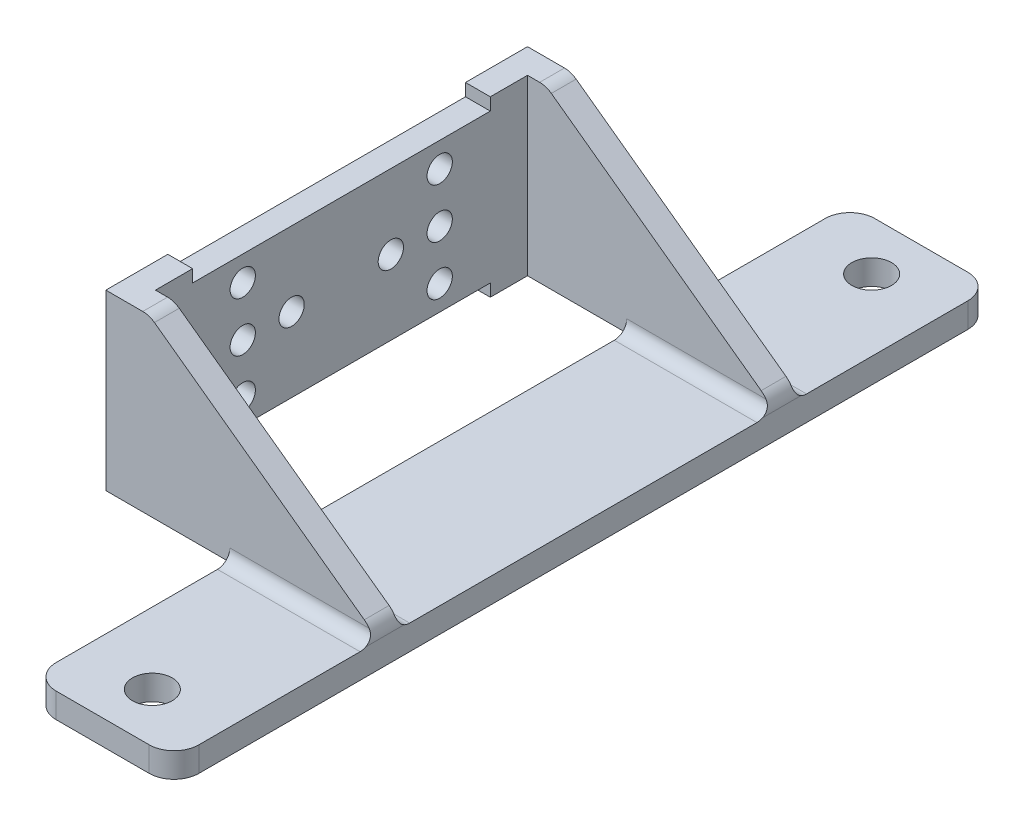
from build123d import *

# Parameters (mm, degrees)
SKETCH1_R           = 4
BOSS_EXTRUDE1_DEPTH = 5
SKETCH2_W           = 5
SKETCH2_H           = 35
BOSS_EXTRUDE2_DEPTH = 53.75
SKETCH3_W           = 75
SKETCH3_H           = 35
SKETCH3_R           = 2.55
BOSS_EXTRUDE3_DEPTH = 5
CHAMFER1_SIZE       = 45
CHAMFER1_SIZE2      = 32.69441376
FILLET1_R           = 4
FILLET2_START       = 98.583917136
FILLET2_DEPTH       = 28.75
FILLET2_START_2     = 25.643804114
FILLET2_2_DEPTH     = 87.749778627
SKETCH4_W           = 60
SKETCH4_H           = 5
CUT_EXTRUDE1_DEPTH  = 5


with BuildPart() as part:
    # Sketch1 → Boss-Extrude1 (new body)
    with BuildSketch(Plane(origin=(0, -83.529928381, 0), x_dir=(1, 0, 0), z_dir=(0, 1, 0))):
        with BuildLine():
            Line((103.583917136, -152.018693427), (122.333917136, -152.018693427))
            ThreePointArc((122.333917136, -152.018693427), (125.869451042, -150.554227333), (127.333917136, -147.018693427))
            Line((127.333917136, -147.018693427), (127.333917136, 7.981306573))
            ThreePointArc((127.333917136, 7.981306573), (125.869451042, 11.516840479), (122.333917136, 12.981306573))
            Line((122.333917136, 12.981306573), (103.583917136, 12.981306573))
            ThreePointArc((103.583917136, 12.981306573), (100.04838323, 11.516840479), (98.583917136, 7.981306573))
            Line((98.583917136, 7.981306573), (98.583917136, -147.018693427))
            ThreePointArc((98.583917136, -147.018693427), (100.04838323, -150.554227333), (103.583917136, -152.018693427))
        make_face()
        with Locations(Location((112.958917136, -142.018693427, 0), (0, 0, 180))):
            Circle(SKETCH1_R, mode=Mode.SUBTRACT)
        with Locations(Location((112.958917136, 2.981306573, 0), (0, 0, 180))):
            Circle(SKETCH1_R, mode=Mode.SUBTRACT)
    extrude(amount=BOSS_EXTRUDE1_DEPTH)

    # Sketch2 → Boss-Extrude2 (add)
    with BuildSketch(Plane(origin=(127.333917136, 0, 0), x_dir=(0, 0, -1), z_dir=(1, 0, 0))):
        with Locations((-109.518693427, -61.029928381)):
            Rectangle(SKETCH2_W, SKETCH2_H)
        with Locations((-29.518693427, -61.029928381)):
            Rectangle(SKETCH2_W, SKETCH2_H)
    extrude(amount=-BOSS_EXTRUDE2_DEPTH)

    # Sketch3 → Boss-Extrude3 (add)
    with BuildSketch(Plane.ZY.offset(-73.583917136)):
        with Locations((69.518693427, -61.029928381)):
            Rectangle(SKETCH3_W, SKETCH3_H)
        with Locations((49.718693427, -61.029928381)):
            Circle(SKETCH3_R, mode=Mode.SUBTRACT)
        with Locations((89.418693427, -61.029928381)):
            Circle(SKETCH3_R, mode=Mode.SUBTRACT)
        with Locations((89.418693427, -71.029928381)):
            Circle(SKETCH3_R, mode=Mode.SUBTRACT)
        with Locations((89.418693427, -51.029928381)):
            Circle(SKETCH3_R, mode=Mode.SUBTRACT)
        with Locations((49.718693427, -51.029928381)):
            Circle(SKETCH3_R, mode=Mode.SUBTRACT)
        with Locations((49.718693427, -71.029928381)):
            Circle(SKETCH3_R, mode=Mode.SUBTRACT)
        with Locations((59.568693427, -61.029928381)):
            Circle(SKETCH3_R, mode=Mode.SUBTRACT)
        with Locations((79.568693427, -61.029928381)):
            Circle(SKETCH3_R, mode=Mode.SUBTRACT)
    extrude(amount=-BOSS_EXTRUDE3_DEPTH)

    # Chamfer1
    chamfer1_edges = [part.edges().sort_by_distance(p)[0] for p in [
        (127.333917136, -43.529928381, 109.518693427),
        (127.333917136, -43.529928381, 29.518693427),
    ]]
    chamfer1_side = [part.faces().sort_by_distance(p)[0] for p in [
        (100.458917136, -43.529928381, 111.013006473),
    ]]
    chamfer(chamfer1_edges, length=CHAMFER1_SIZE, length2=CHAMFER1_SIZE2, reference=chamfer1_side[0])

    # Fillet1
    fillet1_edges = [part.edges().sort_by_distance(p)[0] for p in [
        (127.333917136, -76.224342141, 29.518693427),
        (127.333917136, -76.224342141, 109.518693427),
        (82.333917136, -43.529928381, 29.518693427),
        (82.333917136, -43.529928381, 109.518693427),
    ]]
    fillet(fillet1_edges, radius=FILLET1_R)

    # Fillet2: read off the stored shape, not the designer's step
    # Fillet2 outline → Fillet2 (add)
    with BuildSketch(Plane.YZ.offset(FILLET2_START)):
        with BuildLine():
            ThreePointArc((-78.529928381, 24.518693427), (-77.797695334, 26.28646038), (-76.029928381, 27.018693427))
            Line((-76.029928381, 27.018693427), (-78.529928381, 27.018693427))
            Line((-78.529928381, 27.018693427), (-78.529928381, 24.518693427))
        make_face()
        with BuildLine():
            ThreePointArc((-76.029928381, 32.018693427), (-77.797695334, 32.750926474), (-78.529928381, 34.518693427))
            Line((-78.529928381, 34.518693427), (-78.529928381, 32.018693427))
            Line((-78.529928381, 32.018693427), (-76.029928381, 32.018693427))
        make_face()
        with BuildLine():
            ThreePointArc((-78.529928381, 104.518693427), (-77.797695334, 106.28646038), (-76.029928381, 107.018693427))
            Line((-76.029928381, 107.018693427), (-78.529928381, 107.018693427))
            Line((-78.529928381, 107.018693427), (-78.529928381, 104.518693427))
        make_face()
        with BuildLine():
            ThreePointArc((-76.029928381, 112.018693427), (-77.797695334, 112.750926474), (-78.529928381, 114.518693427))
            Line((-78.529928381, 114.518693427), (-78.529928381, 112.018693427))
            Line((-78.529928381, 112.018693427), (-76.029928381, 112.018693427))
        make_face()
    extrude(amount=FILLET2_DEPTH)

    # Fillet2 2 outline → Fillet2 2 (cut)
    with BuildSketch(Plane.XY.offset(FILLET2_START_2)):
        with BuildLine():
            Line((127.333917136, -76.029928381), (126.652934202, -76.029928381))
            ThreePointArc((126.652934202, -76.029928381), (127.159885528, -77.095411005), (127.333917136, -78.262443939))
            Line((127.333917136, -78.262443939), (127.333917136, -76.029928381))
        make_face()
    extrude(amount=FILLET2_2_DEPTH, mode=Mode.SUBTRACT)

    # Sketch4 → Cut-Extrude1 (cut)
    with BuildSketch(Plane(origin=(78.583917136, 0, 0), x_dir=(0, 0, -1), z_dir=(1, 0, 0))):
        with Locations((-69.518693427, -43.529928381)):
            Rectangle(SKETCH4_W, SKETCH4_H)
        with Locations((-69.518693427, -78.529928381)):
            Rectangle(SKETCH4_W, SKETCH4_H)
    extrude(amount=-CUT_EXTRUDE1_DEPTH, mode=Mode.SUBTRACT)


solid = part.part
